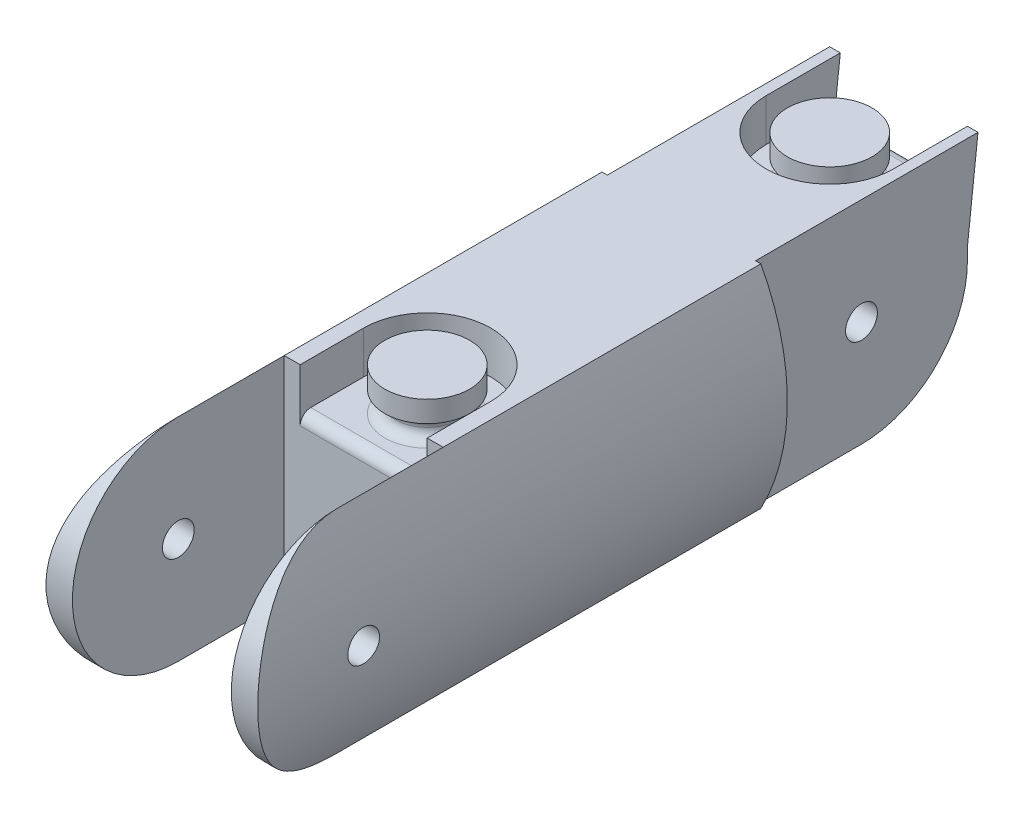
from build123d import *

# Parameters (mm, degrees)
SALIENTE_EXTRUIR2_DEPTH    = 50
CROQUIS4_R                 = 1.5
CORTAR_EXTRUIR1_DEPTH      = 50
SALIENTE_EXTRUIR3_DEPTH    = 20
CROQUIS8_R                 = 1.5
CORTAR_EXTRUIR4_DEPTH      = 14
REDONDEO1_R                = 10
CROQUIS6_W                 = 15
CROQUIS6_H                 = 20
CORTAR_EXTRUIR2_DEPTH      = 20
CORTAR_EXTRUIR3_DEPTH      = 52.961524227
CORTAR_EXTRUIR3_DEPTH_BACK = 52.961524227
CROQUIS7_R                 = 1.5
CUT_EXTRUDE1_DEPTH         = 4
SKETCH2_R                  = 3
BOSS_EXTRUDE1_DEPTH        = 2
SKETCH3_R                  = 4
BOSS_EXTRUDE2_DEPTH        = 2
FILLET2_R                  = 1
FILLET3_R                  = 1
FILLET4_R                  = 1
BOSS_EXTRUDE3_DEPTH        = 1
BOSS_EXTRUDE4_DEPTH        = 1


with BuildPart() as part:
    # Croquis2 → Saliente-Extruir2 (new body)
    with BuildSketch(Plane.XY):
        with BuildLine():
            Line((-7.5, -10), (7.5, -10))
            ThreePointArc((7.5, -10), (10, 0), (7.5, 10))
            Line((7.5, 10), (-7.5, 10))
            ThreePointArc((-7.5, 10), (-10, 0), (-7.5, -10))
        make_face()
    extrude(amount=SALIENTE_EXTRUIR2_DEPTH)

    # Croquis4 → Cortar-Extruir1 (cut)
    with BuildSketch(Plane(origin=(0, 0, 0), x_dir=(-1, 0, 0), z_dir=(0, 0, -1))):
        with Locations((0, -7)):
            Circle(CROQUIS4_R)
    extrude(amount=-CORTAR_EXTRUIR1_DEPTH, mode=Mode.SUBTRACT)

    # Croquis3 → Saliente-Extruir3 (add)
    with BuildSketch(Plane(origin=(0, 0, 0), x_dir=(-1, 0, 0), z_dir=(0, 0, -1))):
        Polygon((7, 10), (7, -10), (3, -10), (3, -3), (-3, -3), (-3, -10), (-7, -10), (-7, 10), align=None)
    extrude(amount=SALIENTE_EXTRUIR3_DEPTH)

    # Croquis8 → Cortar-Extruir4 (cut)
    with BuildSketch(Plane.ZY.offset(7)):
        with Locations((-10, 0)):
            Circle(CROQUIS8_R)
    extrude(amount=-CORTAR_EXTRUIR4_DEPTH, mode=Mode.SUBTRACT)

    # Redondeo1
    redondeo1_edges = [part.edges().sort_by_distance(p)[0] for p in [
        (5, -10, -20),
    ]]
    fillet(redondeo1_edges, radius=REDONDEO1_R)

    # Croquis6 → Cortar-Extruir2 (cut)
    with BuildSketch(Plane.XY.offset(50)):
        Rectangle(CROQUIS6_W, CROQUIS6_H)
    extrude(amount=-CORTAR_EXTRUIR2_DEPTH, mode=Mode.SUBTRACT)

    # Croquis7 → Cortar-Extruir3 (cut, two sides: drawn at the far end of the back side and taken through both)
    with BuildSketch(Plane(origin=(0, 0, 0), x_dir=(0, 0, -1), z_dir=(1, 0, 0)).offset(-CORTAR_EXTRUIR3_DEPTH_BACK)):
        with Locations((-40, 0)):
            Circle(CROQUIS7_R)
        with BuildLine():
            Line((-40, -10), (-55, -10))
            Line((-55, -10), (-55, 10))
            Line((-55, 10), (-40, 10))
            ThreePointArc((-40, 10), (-50, 0), (-40, -10))
        make_face()
    extrude(amount=CORTAR_EXTRUIR3_DEPTH + CORTAR_EXTRUIR3_DEPTH_BACK, mode=Mode.SUBTRACT)

    # Sketch1 → Cut-Extrude1 (cut)
    with BuildSketch(Plane(origin=(0, 10, 0), x_dir=(1, 0, 0), z_dir=(0, 1, 0))):
        with BuildLine():
            Line((-6, -24), (-6, -30))
            Line((-6, -30), (6, -30))
            Line((6, -30), (6, -24))
            ThreePointArc((6, -24), (0, -18), (-6, -24))
        make_face()
        with BuildLine():
            Line((-6, 14), (-6, 20))
            Line((-6, 20), (6, 20))
            Line((6, 20), (6, 14))
            ThreePointArc((6, 14), (0, 8), (-6, 14))
        make_face()
    extrude(amount=-CUT_EXTRUDE1_DEPTH, mode=Mode.SUBTRACT)

    # Sketch2 → Boss-Extrude1 (add)
    with BuildSketch(Plane(origin=(0, 6, 0), x_dir=(1, 0, 0), z_dir=(0, 1, 0))):
        with Locations(Location((0, -24, 0), (0, 0, 270))):
            Circle(SKETCH2_R)
        with Locations(Location((0, 14, 0), (0, 0, 270))):
            Circle(SKETCH2_R)
    extrude(amount=BOSS_EXTRUDE1_DEPTH)

    # Sketch3 → Boss-Extrude2 (add)
    with BuildSketch(Plane(origin=(0, 8, 0), x_dir=(1, 0, 0), z_dir=(0, 1, 0))):
        with Locations(Location((0, -24, 0), (0, 0, 270))):
            Circle(SKETCH3_R)
        with Locations(Location((0, 14, 0), (0, 0, 270))):
            Circle(SKETCH3_R)
    extrude(amount=BOSS_EXTRUDE2_DEPTH)

    # Fillet2
    fillet2_edges = [part.edges().sort_by_distance(p)[0] for p in [
        (0, 6, 21),
        (0, 8, 21),
        (0, 6, -17),
        (0, 8, -17),
    ]]
    fillet(fillet2_edges, radius=FILLET2_R - 0.0001)  # a hair under: the kernel refuses the full size

    # Fillet3
    fillet3_edges = [part.edges().sort_by_distance(p)[0] for p in [
        (0, 6, 30),
        (0, 6, -20),
    ]]
    fillet(fillet3_edges, radius=FILLET3_R)

    # Fillet4
    fillet4_edges = [part.edges().sort_by_distance(p)[0] for p in [
        (1.5, -7, 0),
        (1.5, -7, 30),
    ]]
    fillet(fillet4_edges, radius=FILLET4_R)

    # Sketch4 → Boss-Extrude3 (add)
    with BuildSketch(Plane(origin=(7, 0, 0), x_dir=(0, 0, -1), z_dir=(1, 0, 0))):
        Polygon((20, 10), (21, 10), (19.539392014, -3), align=None)
    extrude(amount=-BOSS_EXTRUDE3_DEPTH)

    # Sketch5 → Boss-Extrude4 (add)
    with BuildSketch(Plane.ZY.offset(7)):
        Polygon((-20, 10), (-21, 10), (-19.539392014, -3), align=None)
    extrude(amount=-BOSS_EXTRUDE4_DEPTH)


solid = part.part
